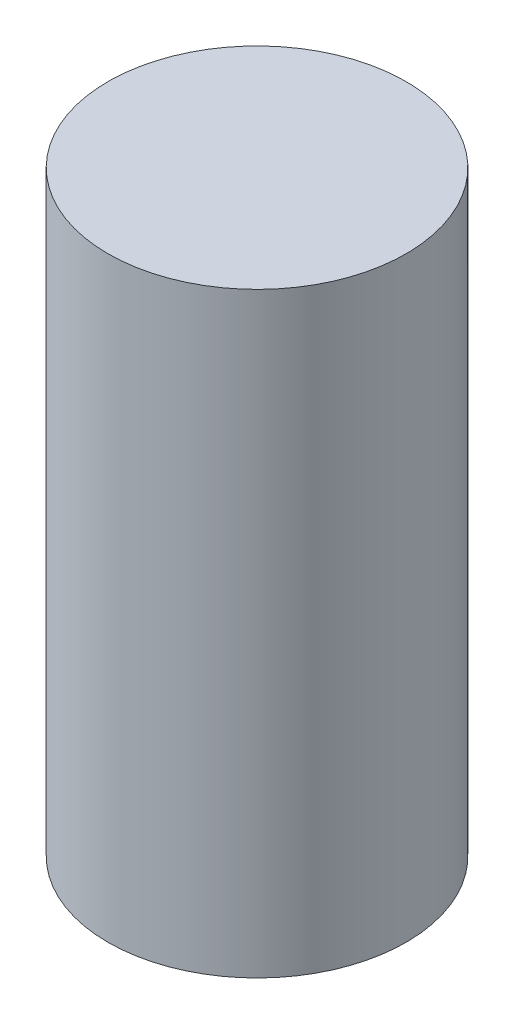
from build123d import *

# Parameters (mm, degrees)
SKETCH1_R           = 5
BOSS_EXTRUDE1_DEPTH = 10


with BuildPart() as part:
    # Sketch1 → Boss-Extrude1 (new, symmetric)
    with BuildSketch(Plane(origin=(0, 0, 0), x_dir=(1, 0, 0), z_dir=(0, 1, 0))):
        Circle(SKETCH1_R)
    extrude(amount=BOSS_EXTRUDE1_DEPTH, both=True)


solid = part.part
